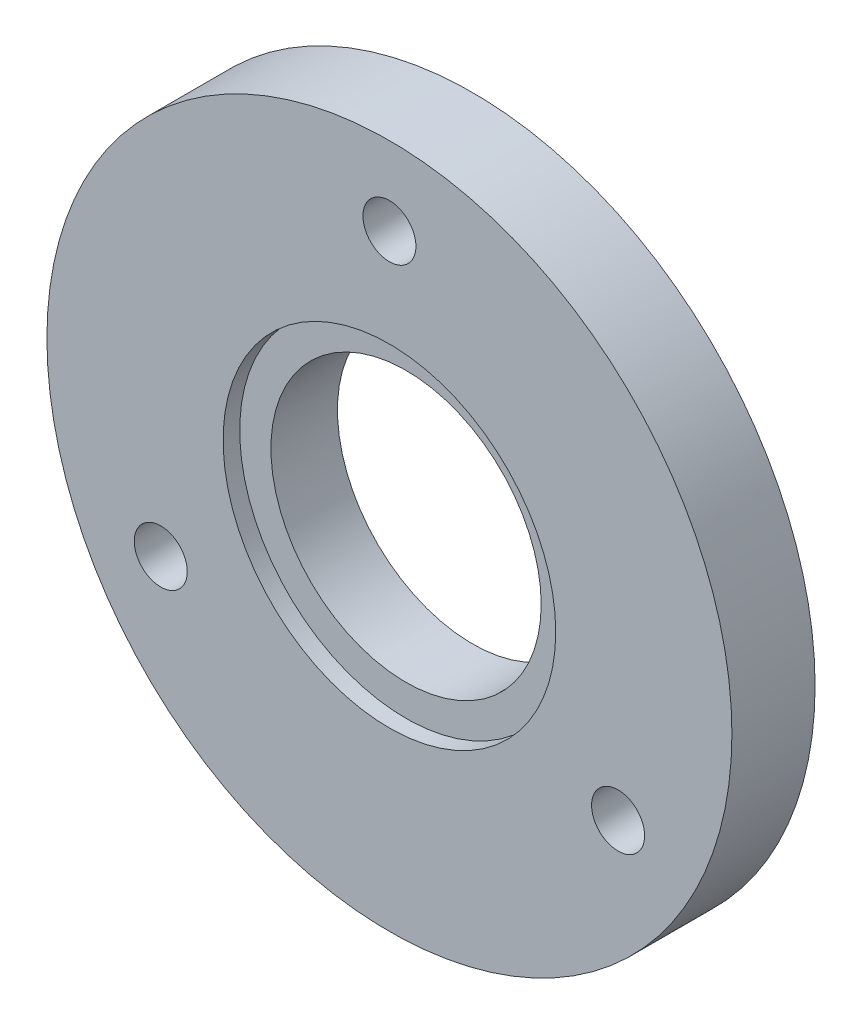
from build123d import *

# Parameters (mm, degrees)
SKETCH1_R           = 32.95
SKETCH1_R_2         = 2.55
SKETCH1_R_3         = 13
BOSS_EXTRUDE1_DEPTH = 8
SKETCH1_7_R         = 32.95
SKETCH1_7_R_2       = 2.55
SKETCH1_7_R_3       = 16
BOSS_EXTRUDE4_DEPTH = 6.35
SKETCH1_10_R        = 16
SKETCH1_10_R_2      = 13
CUT_EXTRUDE1_DEPTH  = 1.6


with BuildPart() as part:
    # Sketch1 → Boss-Extrude1 (new body)
    with BuildSketch(Plane.XY):
        Circle(SKETCH1_R)
        with Locations((-21.997045256, -12.7)):
            Circle(SKETCH1_R_2, mode=Mode.SUBTRACT)
        with Locations((21.997045256, -12.7)):
            Circle(SKETCH1_R_2, mode=Mode.SUBTRACT)
        with Locations((0, 25.4)):
            Circle(SKETCH1_R_2, mode=Mode.SUBTRACT)
        Circle(SKETCH1_R_3, mode=Mode.SUBTRACT)
    extrude(amount=-BOSS_EXTRUDE1_DEPTH)

    # Sketch1<7> → Boss-Extrude4 (add)
    with BuildSketch(Plane.XY):
        Circle(SKETCH1_7_R)
        with Locations((-21.997045256, -12.7)):
            Circle(SKETCH1_7_R_2, mode=Mode.SUBTRACT)
        with Locations((21.997045256, -12.7)):
            Circle(SKETCH1_7_R_2, mode=Mode.SUBTRACT)
        Circle(SKETCH1_7_R_3, mode=Mode.SUBTRACT)
        with Locations((0, 25.4)):
            Circle(SKETCH1_7_R_2, mode=Mode.SUBTRACT)
    extrude(amount=-BOSS_EXTRUDE4_DEPTH)

    # Sketch1<10> → Cut-Extrude1 (cut)
    with BuildSketch(Plane.XY):
        Circle(SKETCH1_10_R)
        Circle(SKETCH1_10_R_2, mode=Mode.SUBTRACT)
    extrude(amount=-CUT_EXTRUDE1_DEPTH, mode=Mode.SUBTRACT)


solid = part.part
